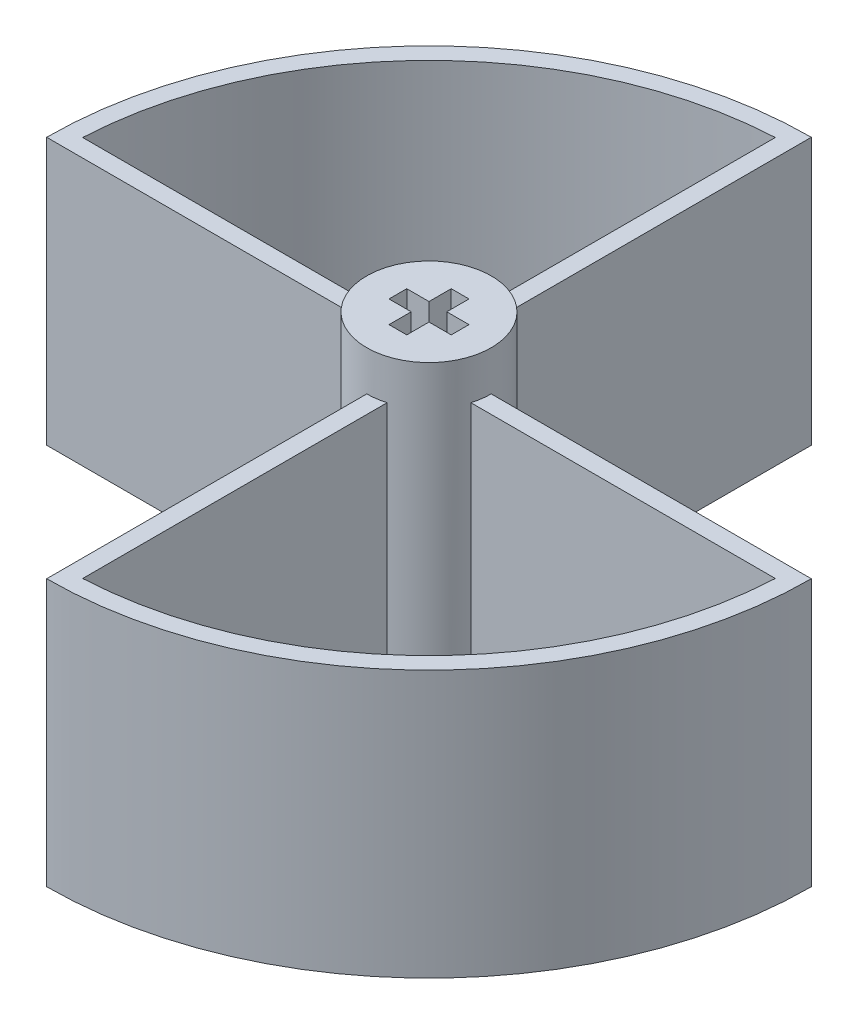
from build123d import *
from build123d.topology import SkipClean

# Parameters (mm, degrees)
EXTRUDE_1_DEPTH      = 30
CUT_EXTRUDE_1_DEPTH  = 68.808554033
SHELL_START          = 2
SHELL_1_DEPTH        = 28
EXTRUDE_2_DEPTH      = 4.5
EXTRUDE_2_DEPTH_BACK = 34.5
SKETCH_3_R           = 7


# Read off the part's stored shape, not the designer's step: 抽壳1
with BuildPart() as part:
    # 草图1 → 凸台-拉伸1 (new body)
    with BuildSketch(Plane(origin=(0, 0, 0), x_dir=(1, 0, 0), z_dir=(0, 1, 0))):
        with BuildLine():
            Line((0, 7), (0, 43))
            ThreePointArc((0, 43), (-30.405591591, 30.405591591), (-43, 0))
            Line((-43, 0), (-7, 0))
            ThreePointArc((-7, 0), (-4.949747468, -4.949747468), (0, -7))
            Line((0, -7), (0, -43))
            ThreePointArc((0, -43), (30.405591591, -30.405591591), (43, 0))
            Line((43, 0), (7, 0))
            ThreePointArc((7, 0), (4.949747468, 4.949747468), (0, 7))
        make_face()
    extrude(amount=EXTRUDE_1_DEPTH)

    # 草图2 → 切除-拉伸1 (cut, through all)
    with BuildSketch(Plane(origin=(0, 30, 0), x_dir=(1, 0, 0), z_dir=(0, 1, 0))):
        Polygon((1, -1), (1, -3.5), (-1, -3.5), (-1, -1), (-3.5, -1), (-3.5, 1), (-1, 1), (-1, 3.5), (1, 3.5), (1, 1), (3.5, 1), (3.5, -1), align=None)
    extrude(amount=-CUT_EXTRUDE_1_DEPTH, mode=Mode.SUBTRACT)

    # 抽壳1 outline → 抽壳1 (cut)
    with BuildSketch(Plane(origin=(0, 0, 0), x_dir=(1, 0, 0), z_dir=(0, 1, 0)).offset(SHELL_START)):
        with BuildLine():
            Line((3, -3), (3, -5.5))
            Line((3, -5.5), (2, -5.5))
            Line((2, -5.5), (2, -40.951190459))
            ThreePointArc((2, -40.951190459), (28.991378029, -28.991378029), (40.951190459, -2))
            Line((40.951190459, -2), (5.5, -2))
            Line((5.5, -2), (5.5, -3))
            Line((5.5, -3), (3, -3))
        make_face()
        with BuildLine():
            Line((3, 4), (3, 3))
            Line((3, 3), (4, 3))
            ThreePointArc((4, 3), (3.535533906, 3.535533906), (3, 4))
        make_face()
        with BuildLine():
            Line((-3, -3), (-4, -3))
            ThreePointArc((-4, -3), (-3.535533906, -3.535533906), (-3, -4))
            Line((-3, -4), (-3, -3))
        make_face()
        with BuildLine():
            ThreePointArc((-2, 40.951190459), (-28.991378029, 28.991378029), (-40.951190459, 2))
            Line((-40.951190459, 2), (-5.5, 2))
            Line((-5.5, 2), (-5.5, 3))
            Line((-5.5, 3), (-3, 3))
            Line((-3, 3), (-3, 5.5))
            Line((-3, 5.5), (-2, 5.5))
            Line((-2, 5.5), (-2, 40.951190459))
        make_face()
    extrude(amount=SHELL_1_DEPTH, mode=Mode.SUBTRACT)

    # 草图3 → 凸台-拉伸2 (add, two sides: drawn at the far end of the back side and taken through both)
    with SkipClean():  # the faces are left unmerged after this step: merging them gives an invalid solid
        with BuildSketch(Plane(origin=(0, 30, 0), x_dir=(1, 0, 0), z_dir=(0, 1, 0)).offset(-EXTRUDE_2_DEPTH_BACK)):
            with Locations(Location((0, 0, 0), (0, 0, 270))):
                Circle(SKETCH_3_R)
            Polygon((-3.5, 1), (-1, 1), (-1, 3.5), (1, 3.5), (1, 1), (3.5, 1), (3.5, -1), (1, -1), (1, -3.5), (-1, -3.5), (-1, -1), (-3.5, -1), align=None, mode=Mode.SUBTRACT)
        extrude(amount=EXTRUDE_2_DEPTH + EXTRUDE_2_DEPTH_BACK)


solid = part.part
